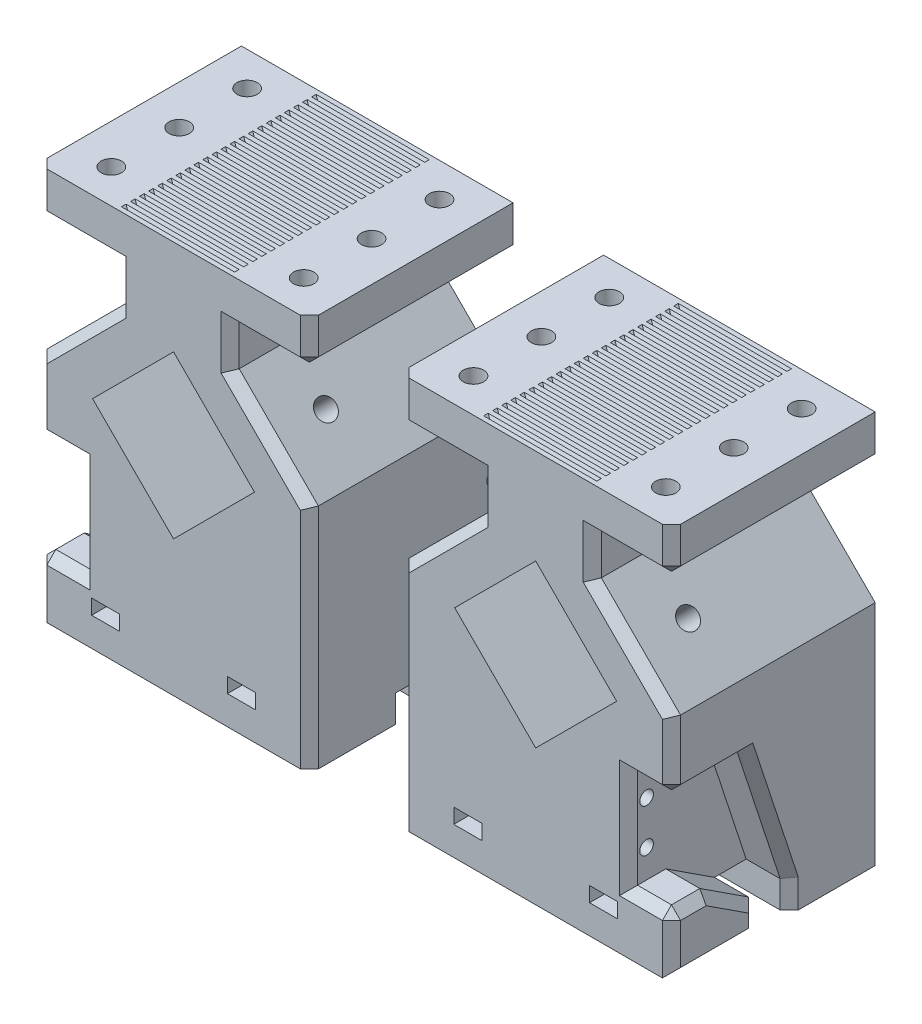
from build123d import *

# Parameters (mm, degrees)
BOSS_EXTRUDE1_DEPTH = 45
CUT_EXTRUDE1_DEPTH  = 25
CUT_EXTRUDE2_DEPTH  = 6
CUT_EXTRUDE4_DEPTH  = 9.5
CUT_EXTRUDE5_DEPTH  = 4.5
FILLET1_R           = 6
CUT_EXTRUDE7_DEPTH  = 23
CHAMFER1_SIZE       = 1
SKETCH8_R           = 2.25
CUT_EXTRUDE8_DEPTH  = 10
CUT_EXTRUDE9_DEPTH  = 3.2
SKETCH10_R          = 1.75
CUT_EXTRUDE10_DEPTH = 20
SKETCH11_W          = 6.2
SKETCH11_H          = 12
CUT_EXTRUDE11_DEPTH = 3.3
CUT_EXTRUDE12_DEPTH = 1.5
SKETCH13_R          = 1.5
CUT_EXTRUDE13_DEPTH = 15
SKETCH14_R          = 2.25
CUT_EXTRUDE14_DEPTH = 15
CUT_EXTRUDE15_DEPTH = 3.5
SKETCH16_R          = 1.8
CUT_EXTRUDE23_DEPTH = 20
SKETCH17_W          = 3.3
SKETCH17_H          = 6.2
CUT_EXTRUDE24_DEPTH = 8
CUT_EXTRUDE25_DEPTH = 1.5
CHAMFER2_SIZE       = 2


with BuildPart() as part:
    # Sketch1 → Boss-Extrude1 (new body)
    with BuildSketch(Plane.XY):
        Polygon((-30, 25.15), (-12.5, 42.65), (-12.5, 51.65), (-30, 51.65), (-30, 61.65), (30, 61.65), (30, 51.65), (12.5, 51.65), (12.5, 42.65), (30, 25.15), (30, -25.15), (-30, -25.15), align=None)
    extrude(amount=BOSS_EXTRUDE1_DEPTH)

    # Sketch2 → Cut-Extrude1 (cut)
    with BuildSketch(Plane.XY.offset(45)):
        Polygon((0, 40.629603128), (-17.889801564, 22.739801564), (0, 4.85), (17.889801564, 22.739801564), align=None)
    extrude(amount=-CUT_EXTRUDE1_DEPTH, mode=Mode.SUBTRACT)

    # Sketch3 → Cut-Extrude2 (cut)
    with BuildSketch(Plane.XZ.offset(25.15)):
        Polygon((-30, 26), (30, 26), (30, 19), (4.5, 19), (4.5, 3), (-4.5, 3), (-4.5, 19), (-30, 19), align=None)
    extrude(amount=-CUT_EXTRUDE2_DEPTH, mode=Mode.SUBTRACT)

    # Sketch4 → Cut-Extrude4 (cut)
    with BuildSketch(Plane.ZY.offset(30)):
        Polygon((45, 9.85), (28.5, 9.85), (19, -19.15), (26, -19.15), (36.75, -12.15), (45, -12.15), align=None)
    extrude(amount=-CUT_EXTRUDE4_DEPTH, mode=Mode.SUBTRACT)

    # Sketch5 → Cut-Extrude5 (cut, symmetric)
    with BuildSketch(Plane(origin=(0, 0, 0), x_dir=(0, 0, -1), z_dir=(1, 0, 0))):
        with BuildLine():
            Line((-3, -19.15), (-3, 9.566528763))
            ThreePointArc((-3, 9.566528763), (-3.277698296, 11.37076356), (-4.085087734, 13.007987381))
            Line((-4.085087734, 13.007987381), (-11.208490038, 23.181260182))
            ThreePointArc((-11.208490038, 23.181260182), (-13.352910624, 25.061866563), (-16.123402303, 25.739801564))
            Line((-16.123402303, 25.739801564), (-20, 25.739801564))
            Line((-20, 25.739801564), (-20, 19.739801564))
            Line((-20, 19.739801564), (-19.246804607, 19.739801564))
            ThreePointArc((-19.246804607, 19.739801564), (-16.476312927, 19.061866563), (-14.331892341, 17.181260182))
            Line((-14.331892341, 17.181260182), (-10.085087734, 11.116194648))
            ThreePointArc((-10.085087734, 11.116194648), (-9.277698296, 9.478970827), (-9, 7.67473603))
            Line((-9, 7.67473603), (-9, -19.15))
            Line((-9, -19.15), (-3, -19.15))
        make_face()
    extrude(amount=CUT_EXTRUDE5_DEPTH, both=True, mode=Mode.SUBTRACT)

    # Fillet1
    fillet1_edges = [part.edges().sort_by_distance(p)[0] for p in [
        (0, -19.15, 9),
    ]]
    fillet(fillet1_edges, radius=FILLET1_R)

    # Sketch7 → Cut-Extrude7 (cut)
    with BuildSketch(Plane(origin=(11.5, 0, 0), x_dir=(0, 0, -1), z_dir=(1, 0, 0))):
        Polygon((-1, 61.65), (-2, 61.65), (-1.5, 60.65), align=None)
        Polygon((-4, 61.65), (-3.5, 60.65), (-3, 61.65), align=None)
        Polygon((-6, 61.65), (-5.5, 60.65), (-5, 61.65), align=None)
        Polygon((-8, 61.65), (-7.5, 60.65), (-7, 61.65), align=None)
        Polygon((-10, 61.65), (-9.5, 60.65), (-9, 61.65), align=None)
        Polygon((-12, 61.65), (-11.5, 60.65), (-11, 61.65), align=None)
        Polygon((-14, 61.65), (-13.5, 60.65), (-13, 61.65), align=None)
        Polygon((-16, 61.65), (-15.5, 60.65), (-15, 61.65), align=None)
        Polygon((-18, 61.65), (-17.5, 60.65), (-17, 61.65), align=None)
        Polygon((-20, 61.65), (-19.5, 60.65), (-19, 61.65), align=None)
        Polygon((-22, 61.65), (-21.5, 60.65), (-21, 61.65), align=None)
        Polygon((-24, 61.65), (-23.5, 60.65), (-23, 61.65), align=None)
        Polygon((-26, 61.65), (-25.5, 60.65), (-25, 61.65), align=None)
        Polygon((-28, 61.65), (-27.5, 60.65), (-27, 61.65), align=None)
        Polygon((-30, 61.65), (-29.5, 60.65), (-29, 61.65), align=None)
        Polygon((-32, 61.65), (-31.5, 60.65), (-31, 61.65), align=None)
        Polygon((-34, 61.65), (-33.5, 60.65), (-33, 61.65), align=None)
        Polygon((-36, 61.65), (-35.5, 60.65), (-35, 61.65), align=None)
        Polygon((-38, 61.65), (-37.5, 60.65), (-37, 61.65), align=None)
        Polygon((-40, 61.65), (-39.5, 60.65), (-39, 61.65), align=None)
        Polygon((-42, 61.65), (-41.5, 60.65), (-41, 61.65), align=None)
        Polygon((-44, 61.65), (-43.5, 60.65), (-43, 61.65), align=None)
    extrude(amount=-CUT_EXTRUDE7_DEPTH, mode=Mode.SUBTRACT)

    # Chamfer1
    chamfer1_edges = [part.edges().sort_by_distance(p)[0] for p in [
        (-11.5, 61.65, 43.5),
        (-11.5, 61.65, 41.5),
        (-11.5, 61.65, 39.5),
        (-11.5, 61.65, 37.5),
        (-11.5, 61.65, 35.5),
        (-11.5, 61.65, 33.5),
        (-11.5, 61.65, 31.5),
        (-11.5, 61.65, 29.5),
        (-11.5, 61.65, 27.5),
        (-11.5, 61.65, 25.5),
        (-11.5, 61.65, 23.5),
        (-11.5, 61.65, 21.5),
        (-11.5, 61.65, 19.5),
        (-11.5, 61.65, 17.5),
        (-11.5, 61.65, 15.5),
        (-11.5, 61.65, 13.5),
        (-11.5, 61.65, 11.5),
        (-11.5, 61.65, 9.5),
        (-11.5, 61.65, 7.5),
        (-11.5, 61.65, 5.5),
        (-11.5, 61.65, 3.5),
        (-11.5, 61.65, 1.5),
        (11.5, 61.65, 43.5),
        (11.5, 61.65, 41.5),
        (11.5, 61.65, 39.5),
        (11.5, 61.65, 37.5),
        (11.5, 61.65, 35.5),
        (11.5, 61.65, 33.5),
        (11.5, 61.65, 31.5),
        (11.5, 61.65, 29.5),
        (11.5, 61.65, 27.5),
        (11.5, 61.65, 25.5),
        (11.5, 61.65, 23.5),
        (11.5, 61.65, 21.5),
        (11.5, 61.65, 19.5),
        (11.5, 61.65, 17.5),
        (11.5, 61.65, 15.5),
        (11.5, 61.65, 13.5),
        (11.5, 61.65, 11.5),
        (11.5, 61.65, 9.5),
        (11.5, 61.65, 7.5),
        (11.5, 61.65, 5.5),
        (11.5, 61.65, 3.5),
        (11.5, 61.65, 1.5),
    ]]
    chamfer(chamfer1_edges, length=CHAMFER1_SIZE - 0.0001)  # a hair under: the kernel refuses the full size

    # Sketch8 → Cut-Extrude8 (cut)
    with BuildSketch(Plane(origin=(0, 61.65, 0), x_dir=(1, 0, 0), z_dir=(0, 1, 0))):
        with Locations(Location((-21.25, -37.5, 0), (0, 0, 270))):
            Circle(SKETCH8_R)
        with Locations(Location((-21.25, -22.5, 0), (0, 0, 270))):
            Circle(SKETCH8_R)
        with Locations(Location((-21.25, -7.5, 0), (0, 0, 270))):
            Circle(SKETCH8_R)
        with Locations(Location((21.25, -7.5, 0), (0, 0, 270))):
            Circle(SKETCH8_R)
        with Locations(Location((21.25, -22.5, 0), (0, 0, 270))):
            Circle(SKETCH8_R)
        with Locations(Location((21.25, -37.5, 0), (0, 0, 270))):
            Circle(SKETCH8_R)
    extrude(amount=-CUT_EXTRUDE8_DEPTH, mode=Mode.SUBTRACT)

    # Sketch9 → Cut-Extrude9 (cut)
    with BuildSketch(Plane.XZ.offset(-51.65)):
        Polygon((-25.291451884, 22.5), (-23.270725942, 19), (-19.229274058, 19), (-17.208548116, 22.5), (-19.229274058, 26), (-23.270725942, 26), align=None)
        Polygon((-25.291451884, 37.5), (-23.270725942, 34), (-19.229274058, 34), (-17.208548116, 37.5), (-19.229274058, 41), (-23.270725942, 41), align=None)
        Polygon((-25.291451884, 7.5), (-23.270725942, 4), (-19.229274058, 4), (-17.208548116, 7.5), (-19.229274058, 11), (-23.270725942, 11), align=None)
        Polygon((25.291451884, 7.5), (23.270725942, 11), (19.229274058, 11), (17.208548116, 7.5), (19.229274058, 4), (23.270725942, 4), align=None)
        Polygon((25.483397492, 22.610819848), (23.46267155, 26.110819848), (19.421219665, 26.110819848), (17.400493723, 22.610819848), (19.421219665, 19.110819848), (23.46267155, 19.110819848), align=None)
        Polygon((25.483397492, 37.610819848), (23.46267155, 41.110819848), (19.421219665, 41.110819848), (17.400493723, 37.610819848), (19.421219665, 34.110819848), (23.46267155, 34.110819848), align=None)
    extrude(amount=-CUT_EXTRUDE9_DEPTH, mode=Mode.SUBTRACT)

    # Sketch10 → Cut-Extrude10 (cut)
    with BuildSketch(Plane.XZ.offset(25.15)):
        with Locations((-15, 37.5)):
            Circle(SKETCH10_R)
        with Locations((-15, 7.5)):
            Circle(SKETCH10_R)
        with Locations((15, 7.5)):
            Circle(SKETCH10_R)
        with Locations((15, 37.5)):
            Circle(SKETCH10_R)
    extrude(amount=-CUT_EXTRUDE10_DEPTH, mode=Mode.SUBTRACT)

    # Sketch11 → Cut-Extrude11 (cut)
    with BuildSketch(Plane(origin=(0, -18.8, 0), x_dir=(-1, 0, 0), z_dir=(0, -1, 0))):
        with Locations((-15, -39)):
            Rectangle(SKETCH11_W, SKETCH11_H)
        with Locations((15, -39)):
            Rectangle(SKETCH11_W, SKETCH11_H)
        with Locations((15, -6)):
            Rectangle(SKETCH11_W, SKETCH11_H)
        with Locations((-15, -6)):
            Rectangle(SKETCH11_W, SKETCH11_H)
    extrude(amount=-CUT_EXTRUDE11_DEPTH, mode=Mode.SUBTRACT)

    # Sketch12 → Cut-Extrude12 (cut)
    with BuildSketch(Plane(origin=(0, -18.8, 0), x_dir=(-1, 0, 0), z_dir=(0, -1, 0))):
        Polygon((15, -34.035898385), (12, -35.767949192), (12, -39.232050808), (15, -40.964101615), (18, -39.232050808), (18, -35.767949192), align=None)
        Polygon((15, -10.964101615), (18, -9.232050808), (18, -5.767949192), (15, -4.035898385), (12, -5.767949192), (12, -9.232050808), align=None)
        Polygon((-15, -10.964101615), (-12, -9.232050808), (-12, -5.767949192), (-15, -4.035898385), (-18, -5.767949192), (-18, -9.232050808), align=None)
        Polygon((-15, -34.035898385), (-18, -35.767949192), (-18, -39.232050808), (-15, -40.964101615), (-12, -39.232050808), (-12, -35.767949192), align=None)
    extrude(amount=CUT_EXTRUDE12_DEPTH, mode=Mode.SUBTRACT)

    # Sketch13 → Cut-Extrude13 (cut)
    with BuildSketch(Plane.ZY.offset(20.5)):
        with Locations((41, -5.9)):
            Circle(SKETCH13_R)
        with Locations((41, 3.6)):
            Circle(SKETCH13_R)
    extrude(amount=-CUT_EXTRUDE13_DEPTH, mode=Mode.SUBTRACT)

    # Sketch14 → Cut-Extrude14 (cut)
    with BuildSketch(Plane(origin=(-27.575, 27.575, 0), x_dir=(0, 0, 1), z_dir=(-0.7071067811865477, 0.7071067811865475, 0))):
        with Locations(Location((32.5, 9.070532111, 0), (0, 0, 270))):
            Circle(SKETCH14_R)
    cut_extrude14 = extrude(amount=-CUT_EXTRUDE14_DEPTH, mode=Mode.SUBTRACT)

    # Sketch15 → Cut-Extrude15 (cut)
    with BuildSketch(Plane(origin=(-20.314801564, 20.314801564, 0), x_dir=(0, 0, -1), z_dir=(0.7071067811865477, -0.7071067811865475, 0))):
        Polygon((-28.458548116, 9.070532111), (-30.479274058, 12.570532111), (-34.520725942, 12.570532111), (-36.541451884, 9.070532111), (-34.520725942, 5.570532111), (-30.479274058, 5.570532111), align=None)
    cut_extrude15 = extrude(amount=-CUT_EXTRUDE15_DEPTH, mode=Mode.SUBTRACT)

    # Mirror1: Cut-Extrude14, Cut-Extrude15 across plane
    add(cut_extrude14.mirror(Plane(origin=(0, 0, 0), x_dir=(0, 0, 1), z_dir=(1, 0, 0))), mode=Mode.SUBTRACT)
    add(cut_extrude15.mirror(Plane(origin=(0, 0, 0), x_dir=(0, 0, 1), z_dir=(1, 0, 0))), mode=Mode.SUBTRACT)

    # Sketch16 → Cut-Extrude23 (cut)
    with BuildSketch(Plane(origin=(30, 0, 0), x_dir=(0, 0, -1), z_dir=(1, 0, 0))):
        with Locations(Location((-4, 11.25, 0), (0, 0, 90))):
            Circle(SKETCH16_R)
        with Locations(Location((-4, -11.25, 0), (0, 0, 90))):
            Circle(SKETCH16_R)
    extrude(amount=-CUT_EXTRUDE23_DEPTH, mode=Mode.SUBTRACT)

    # Sketch17 → Cut-Extrude24 (cut)
    with BuildSketch(Plane(origin=(0, 0, 0), x_dir=(-1, 0, 0), z_dir=(0, 0, -1))):
        with Locations((-22, -11.25)):
            Rectangle(SKETCH17_W, SKETCH17_H)
        with Locations((-22, 11.25)):
            Rectangle(SKETCH17_W, SKETCH17_H)
    extrude(amount=-CUT_EXTRUDE24_DEPTH, mode=Mode.SUBTRACT)

    # Sketch18 → Cut-Extrude25 (cut)
    with BuildSketch(Plane.ZY.offset(-23.65)):
        Polygon((0.824573519, 11.25), (2.41228676, 8.5), (5.58771324, 8.5), (7.175426481, 11.25), (5.58771324, 14), (2.41228676, 14), align=None)
        Polygon((0.824573519, -11.25), (2.41228676, -14), (5.58771324, -14), (7.175426481, -11.25), (5.58771324, -8.5), (2.41228676, -8.5), align=None)
    extrude(amount=-CUT_EXTRUDE25_DEPTH, mode=Mode.SUBTRACT)

    # Chamfer2
    chamfer2_edges = [part.edges().sort_by_distance(p)[0] for p in [
        (-30, -25.15, 35.5),
        (-30, -22.15, 26),
        (-30, -15.65, 31.375),
        (-30, -12.15, 40.875),
        (-30, -18.65, 45),
        (-30, -22.15, 19),
        (-30, -4.65, 23.75),
        (-30, 9.85, 36.75),
        (-25.25, -12.15, 45),
        (-20.5, -1.15, 45),
        (-25.25, 9.85, 45),
        (-30, 17.5, 45),
        (-30, 51.65, 22.5),
        (-21.25, 33.9, 45),
        (-12.5, 47.15, 45),
        (-21.25, 51.65, 45),
        (-30, 56.65, 45),
        (30, 0, 45),
        (21.25, 33.9, 45),
        (12.5, 47.15, 45),
        (21.25, 51.65, 45),
        (30, 56.65, 45),
        (30, 51.65, 22.5),
    ]]
    chamfer(chamfer2_edges, length=CHAMFER2_SIZE)


with BuildPart() as body_2:
    # Mirror4: mirrored copy
    add(part.part.mirror(Plane(origin=(40, 0, 0), x_dir=(0, 0, 1), z_dir=(1, 0, 0))))


solid = Compound([part.part, body_2.part])
